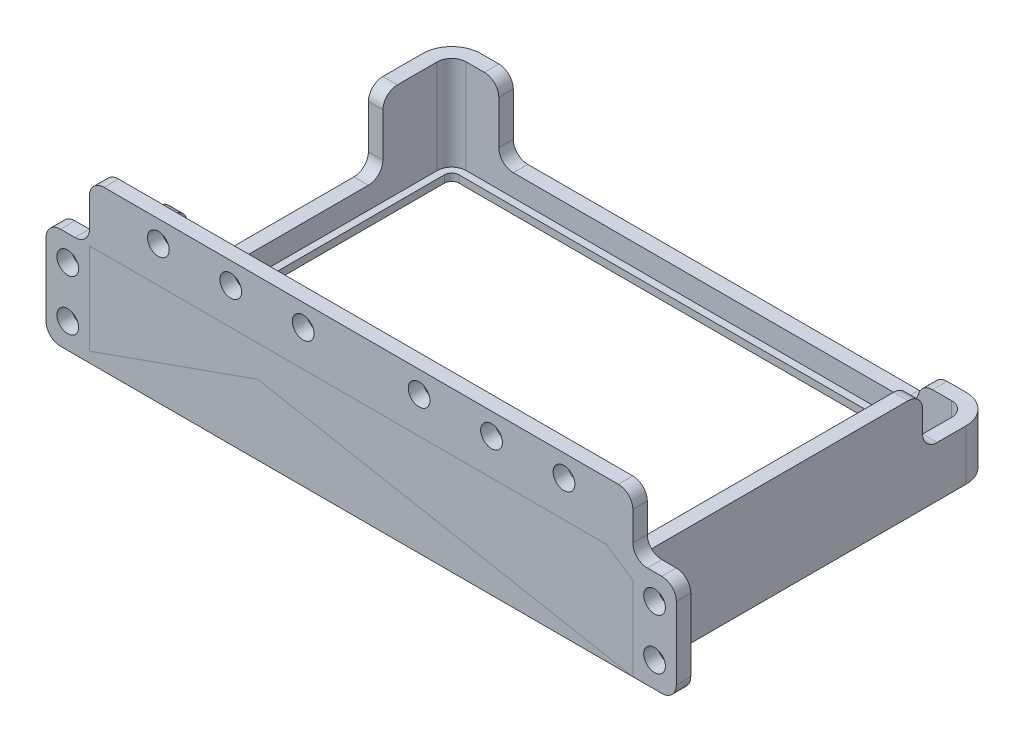
from build123d import *

# Parameters (mm, degrees)
EXTRUDE_THIN1_DEPTH = 13
CUT_EXTRUDE1_REACH  = 65.838
BOSS_EXTRUDE2_START = 1
BOSS_EXTRUDE2_DEPTH = 1
CUT_EXTRUDE2_REACH  = 82.119
SKETCH5_W           = 8.5
SKETCH5_H           = 10
CUT_EXTRUDE3_DEPTH  = 7
FILLET1_R           = 2
DELETEFACE1_START   = -1
DELETEFACE1_DEPTH   = 14
SKETCH7_W           = 75
SKETCH7_H           = 14
BOSS_EXTRUDE3_DEPTH = 2
SKETCH8_R           = 1.5
CUT_EXTRUDE4_DEPTH  = 10


# Read off the part's stored shape, not the designer's step: DeleteFace1
with BuildPart() as part:
    # Sketch1 → Extrude-Thin1 (new body)
    with BuildSketch(Plane(origin=(0, 0, 0), x_dir=(1, 0, 0), z_dir=(0, 1, 0))):
        with BuildLine():
            Line((33.5, -25), (-33.5, -25))
            ThreePointArc((-33.5, -25), (-36.328427125, -23.828427125), (-37.5, -21))
            Line((-37.5, -21), (-37.5, 21))
            ThreePointArc((-37.5, 21), (-36.328427125, 23.828427125), (-33.5, 25))
            Line((-33.5, 25), (33.5, 25))
            ThreePointArc((33.5, 25), (36.328427125, 23.828427125), (37.5, 21))
            Line((37.5, 21), (37.5, -21))
            ThreePointArc((37.5, -21), (36.328427125, -23.828427125), (33.5, -25))
        make_face()
        with BuildLine():
            Line((33.5, -23), (-33.5, -23))
            ThreePointArc((-33.5, -23), (-34.914213562, -22.414213562), (-35.5, -21))
            Line((-35.5, -21), (-35.5, 21))
            ThreePointArc((-35.5, 21), (-34.914213562, 22.414213562), (-33.5, 23))
            Line((-33.5, 23), (33.5, 23))
            ThreePointArc((33.5, 23), (34.914213562, 22.414213562), (35.5, 21))
            Line((35.5, 21), (35.5, -21))
            ThreePointArc((35.5, -21), (34.914213562, -22.414213562), (33.5, -23))
        make_face(mode=Mode.SUBTRACT)
    extrude(amount=EXTRUDE_THIN1_DEPTH)

    # Sketch2 → Cut-Extrude1 (cut, up to next)
    with BuildSketch(Plane(origin=(0, 0, -25), x_dir=(-1, 0, 0), z_dir=(0, 0, -1)), mode=Mode.PRIVATE) as cut_extrude1_sk1:
        with BuildLine():
            Line((-29, 13), (29, 13))
            Line((29, 13), (29, 5))
            ThreePointArc((29, 5), (28.414213562, 3.585786438), (27, 3))
            Line((27, 3), (-27, 3))
            ThreePointArc((-27, 3), (-28.414213562, 3.585786438), (-29, 5))
            Line((-29, 5), (-29, 13))
        make_face()
    cut_extrude1_tool1 = extrude(cut_extrude1_sk1.sketch, amount=-CUT_EXTRUDE1_REACH, mode=Mode.PRIVATE) & part.part
    add(cut_extrude1_tool1.solids().sort_by_distance((0, 8.013518, -25))[0], mode=Mode.SUBTRACT)

    # Sketch3 → Boss-Extrude2 (add)
    with BuildSketch(Plane.XZ.offset(BOSS_EXTRUDE2_START)):
        with BuildLine():
            Line((37.5, -21), (37.5, 21))
            ThreePointArc((37.5, 21), (36.328427125, 23.828427125), (33.5, 25))
            Line((33.5, 25), (-33.5, 25))
            ThreePointArc((-33.5, 25), (-36.328427125, 23.828427125), (-37.5, 21))
            Line((-37.5, 21), (-37.5, -21))
            ThreePointArc((-37.5, -21), (-36.328427125, -23.828427125), (-33.5, -25))
            Line((-33.5, -25), (33.5, -25))
            ThreePointArc((33.5, -25), (36.328427125, -23.828427125), (37.5, -21))
        make_face()
        with BuildLine():
            Line((34.5, -21), (34.5, 21))
            ThreePointArc((34.5, 21), (34.207106781, 21.707106781), (33.5, 22))
            Line((33.5, 22), (-33.5, 22))
            ThreePointArc((-33.5, 22), (-34.207106781, 21.707106781), (-34.5, 21))
            Line((-34.5, 21), (-34.5, -21))
            ThreePointArc((-34.5, -21), (-34.207106781, -21.707106781), (-33.5, -22))
            Line((-33.5, -22), (33.5, -22))
            ThreePointArc((33.5, -22), (34.207106781, -21.707106781), (34.5, -21))
        make_face(mode=Mode.SUBTRACT)
    extrude(amount=-BOSS_EXTRUDE2_DEPTH)

    # Sketch4 → Cut-Extrude2 (cut, up to next)
    with BuildSketch(Plane.ZY.offset(37.5), mode=Mode.PRIVATE) as cut_extrude2_sk1:
        with BuildLine():
            Line((-13.5, 13), (13.5, 13))
            Line((13.5, 13), (13.5, 5))
            ThreePointArc((13.5, 5), (12.914213562, 3.585786438), (11.5, 3))
            Line((11.5, 3), (-11.5, 3))
            ThreePointArc((-11.5, 3), (-12.914213562, 3.585786438), (-13.5, 5))
            Line((-13.5, 5), (-13.5, 13))
        make_face()
    cut_extrude2_tool1 = extrude(cut_extrude2_sk1.sketch, amount=-CUT_EXTRUDE2_REACH, mode=Mode.PRIVATE) & part.part
    add(cut_extrude2_tool1.solids().sort_by_distance((-37.5, 8.029138, 0))[0], mode=Mode.SUBTRACT)

    # Sketch5 → Cut-Extrude3 (cut)
    with BuildSketch(Plane(origin=(0, 13, 0), x_dir=(1, 0, 0), z_dir=(0, 1, 0))):
        with Locations((33.25, 20)):
            Rectangle(SKETCH5_W, SKETCH5_H)
    extrude(amount=-CUT_EXTRUDE3_DEPTH, mode=Mode.SUBTRACT)

    # Fillet1
    fillet1_edges = [part.edges().sort_by_distance(p)[0] for p in [
        (-29, 13, -24),
        (29, 6, -24),
        (-36.5, 13, 13.5),
        (-36.5, 13, -13.5),
        (36.5, 6, -15),
        (36.5, 13, -15),
    ]]
    fillet(fillet1_edges, radius=FILLET1_R)

    # DeleteFace1 outline → DeleteFace1 (add)
    with BuildSketch(Plane(origin=(0, 0, 0), x_dir=(1, 0, 0), z_dir=(0, 1, 0)).offset(DELETEFACE1_START)):
        with BuildLine():
            Line((-37.5, -25), (-33.5, -25))
            ThreePointArc((-33.5, -25), (-36.328427125, -23.828427125), (-37.5, -21))
            Line((-37.5, -21), (-37.5, -25))
        make_face()
        with BuildLine():
            ThreePointArc((37.5, -21), (36.328427125, -23.828427125), (33.5, -25))
            Line((33.5, -25), (37.5, -25))
            Line((37.5, -25), (37.5, -21))
        make_face()
    extrude(amount=DELETEFACE1_DEPTH)


with BuildPart() as body_2:
    # Sketch7 → Boss-Extrude3 (new body)
    with BuildSketch(Plane.XY.offset(25)):
        with BuildLine():
            Line((-39.5, 13), (-41.5, 13))
            ThreePointArc((-41.5, 13), (-42.914213562, 12.414213562), (-43.5, 11))
            Line((-43.5, 11), (-43.5, 1))
            ThreePointArc((-43.5, 1), (-42.914213562, -0.414213562), (-41.5, -1))
            Line((-41.5, -1), (-37.5, -1))
            Line((-37.5, -1), (-37.5, 13))
            Line((-37.5, 13), (0, 13))
            Line((0, 13), (37.5, 13))
            Line((37.5, 13), (39.5, 13))
            ThreePointArc((39.5, 13), (38.085786438, 13.585786438), (37.5, 15))
            Line((37.5, 15), (37.5, 19))
            ThreePointArc((37.5, 19), (36.914213562, 20.414213562), (35.5, 21))
            Line((35.5, 21), (-35.5, 21))
            ThreePointArc((-35.5, 21), (-36.914213562, 20.414213562), (-37.5, 19))
            Line((-37.5, 19), (-37.5, 15))
            ThreePointArc((-37.5, 15), (-38.085786438, 13.585786438), (-39.5, 13))
        make_face()
        with Locations((0, 6)):
            Rectangle(SKETCH7_W, SKETCH7_H)
        with BuildLine():
            Line((37.5, 13), (37.5, -1))
            Line((37.5, -1), (41.5, -1))
            ThreePointArc((41.5, -1), (42.914213562, -0.414213562), (43.5, 1))
            Line((43.5, 1), (43.5, 11))
            ThreePointArc((43.5, 11), (42.914213562, 12.414213562), (41.5, 13))
            Line((41.5, 13), (39.5, 13))
            Line((39.5, 13), (37.5, 13))
        make_face()
    extrude(amount=-BOSS_EXTRUDE3_DEPTH)

    # Sketch8 → Cut-Extrude4 (cut)
    with BuildSketch(Plane(origin=(0, 0, 23), x_dir=(-1, 0, 0), z_dir=(0, 0, -1))):
        with Locations((-40.5, 9.5)):
            Circle(SKETCH8_R)
        with Locations(Location((-40.5, 2.5, 0), (0, 0, 180))):
            Circle(SKETCH8_R)
        with Locations(Location((40.5, 9.5, 0), (0, 0, 180))):
            Circle(SKETCH8_R)
        with Locations((40.5, 2.5)):
            Circle(SKETCH8_R)
        with Locations(Location((8, 18, 0), (0, 0, 180))):
            Circle(SKETCH8_R)
        with Locations(Location((18, 18, 0), (0, 0, 180))):
            Circle(SKETCH8_R)
        with Locations((-8, 18)):
            Circle(SKETCH8_R)
        with Locations((-18, 18)):
            Circle(SKETCH8_R)
        with Locations((-28, 18)):
            Circle(SKETCH8_R)
        with Locations(Location((28, 18, 0), (0, 0, 180))):
            Circle(SKETCH8_R)
    extrude(amount=-CUT_EXTRUDE4_DEPTH, mode=Mode.SUBTRACT)


solid = Compound([part.part, body_2.part])
